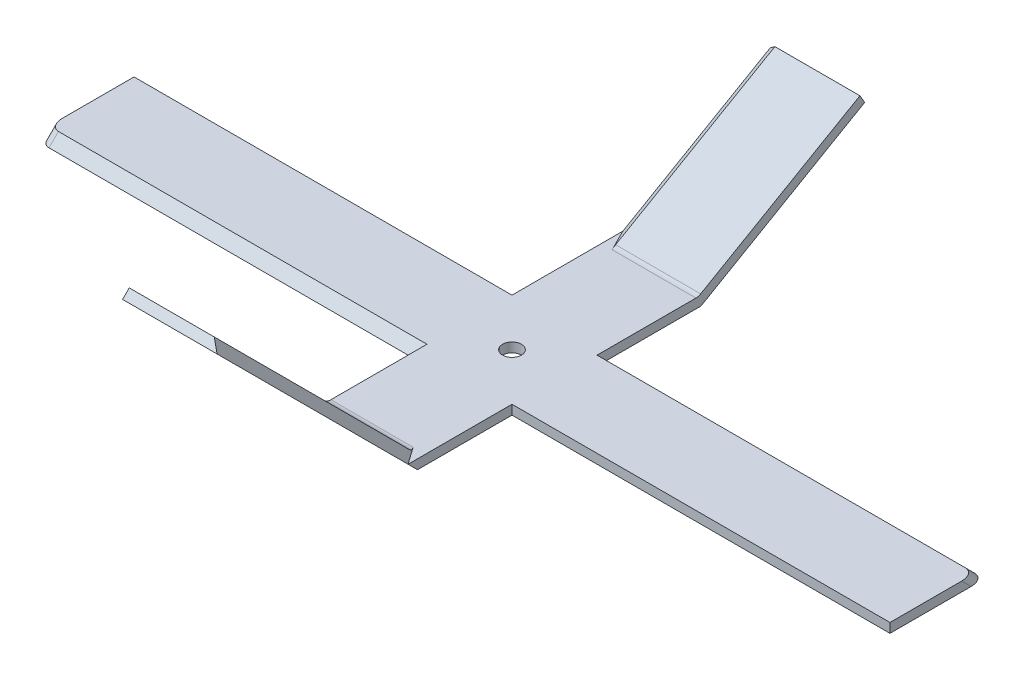
from build123d import *

# Parameters (mm, degrees)
TOP_BLADE_FIRST_EXTRUDE_DEPTH  = 10
SKETCH3_W                      = 40
SKETCH3_H                      = 10
TOP_BLADE_SECOND_EXTRUDE_DEPTH = 1
TOP_BLADE_CUT_1_SIZE           = 1
TOP_BLADE_ROUNDING_1_R         = 1
SKETCH5_R                      = 1
TOP_BLADE_CUT_2_DEPTH          = 19
TOP_BLADE_ROUNDING_2_R         = 1


with BuildPart() as part:
    # Sketch1 → Top Blade First Extrude (new body)
    with BuildSketch(Plane(origin=(0, 0, 0), x_dir=(0, 0, -1), z_dir=(1, 0, 0))):
        Polygon((-14.254658385, 0), (15.745341615, 0), (33.065849691, 10), (32.565849691, 10.866025404), (15.477392422, 1), (-13.840444823, 1), (-34.76075504, 21.920310217), (-35.467861821, 21.213203436), align=None)
    extrude(amount=TOP_BLADE_FIRST_EXTRUDE_DEPTH)

    # Sketch3 → Top Blade Second Extrude (add)
    with BuildSketch(Plane.XZ):
        with Locations((-20, -0.745341615)):
            Rectangle(SKETCH3_W, SKETCH3_H)
        with Locations((30, -0.745341615)):
            Rectangle(SKETCH3_W, SKETCH3_H)
    extrude(amount=-TOP_BLADE_SECOND_EXTRUDE_DEPTH)

    # Top Blade Cut 1
    top_blade_cut_1_edges = [part.edges().sort_by_distance(p)[0] for p in [
        (-20, 1, 4.254658385),
        (0, 5.933012702, -24.021621057),
        (30, 1, -5.745341615),
        (10, 11.460155108, 24.300599931),
    ]]
    chamfer(top_blade_cut_1_edges, length=TOP_BLADE_CUT_1_SIZE - 0.0001)  # a hair under: the kernel refuses the full size

    # Top Blade Rounding 1
    top_blade_rounding_1_edges = [part.edges().sort_by_distance(p)[0] for p in [
        (-40, 0.50005, 3.754708385),
        (50, 0.50005, -5.245391615),
    ]]
    fillet(top_blade_rounding_1_edges, radius=TOP_BLADE_ROUNDING_1_R)

    # Sketch5 → Top Blade Cut 2 (cut)
    with BuildSketch(Plane.XZ):
        with Locations(Location((5, -0.745341615, 0), (0, 0, 270))):
            Circle(SKETCH5_R)
    extrude(amount=-TOP_BLADE_CUT_2_DEPTH, mode=Mode.SUBTRACT)

    # Top Blade Rounding 2
    top_blade_rounding_2_edges = [part.edges().sort_by_distance(p)[0] for p in [
        (4.50005, 1, 13.840444823),
        (5.49995, 1, -15.477392422),
    ]]
    fillet(top_blade_rounding_2_edges, radius=TOP_BLADE_ROUNDING_2_R)


solid = part.part
